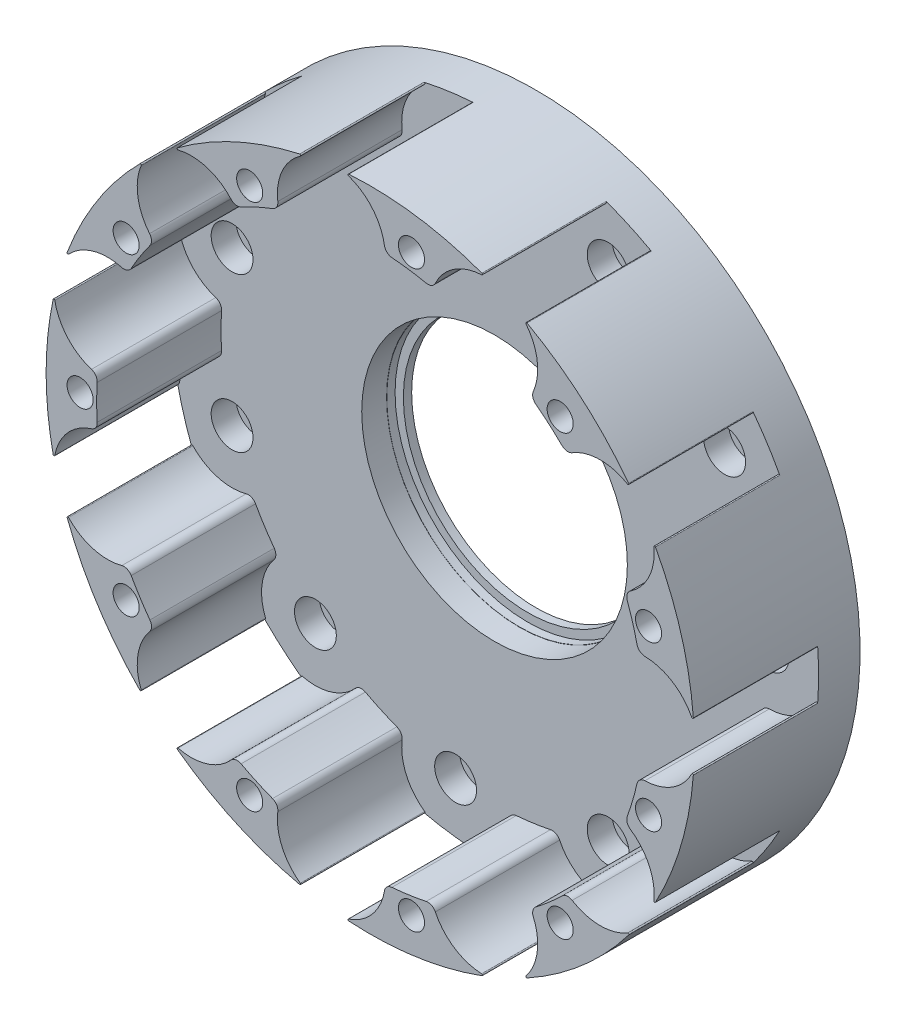
from build123d import *

# Parameters (mm, degrees)
SKETCH1_R           = 39.1
SKETCH1_R_2         = 2.525
SKETCH1_R_3         = 16.025
BOSS_EXTRUDE1_DEPTH = 3
BOSS_EXTRUDE2_START = 2
SKETCH2_R           = 39.1
SKETCH2_R_2         = 16
BOSS_EXTRUDE2_DEPTH = 2
SKETCH4_R           = 16
SKETCH4_R_2         = 15
BOSS_EXTRUDE3_DEPTH = 1
BOSS_EXTRUDE4_DEPTH = 15
FILLET1_R           = 0.1
FILLET2_R           = 1
SKETCH7_R           = 1.575
CUT_EXTRUDE1_DEPTH  = 59.801530759
CUT_EXTRUDE3_DEPTH  = 3


with BuildPart() as part:
    # Sketch1 → Boss-Extrude1 (new body)
    with BuildSketch(Plane.XY):
        Circle(SKETCH1_R)
        with Locations((33, 0)):
            Circle(SKETCH1_R_2, mode=Mode.SUBTRACT)
        with Locations((27.761366583, -17.841146976)):
            Circle(SKETCH1_R_2, mode=Mode.SUBTRACT)
        with Locations((13.708695429, -30.017855847)):
            Circle(SKETCH1_R_2, mode=Mode.SUBTRACT)
        with Locations((-4.696389663, -32.664107582)):
            Circle(SKETCH1_R_2, mode=Mode.SUBTRACT)
        with Locations((-21.61040422, -24.939735954)):
            Circle(SKETCH1_R_2, mode=Mode.SUBTRACT)
        with Locations((-31.663268129, -9.297174376)):
            Circle(SKETCH1_R_2, mode=Mode.SUBTRACT)
        with Locations((-31.663268129, 9.297174376)):
            Circle(SKETCH1_R_2, mode=Mode.SUBTRACT)
        with Locations((-21.61040422, 24.939735954)):
            Circle(SKETCH1_R_2, mode=Mode.SUBTRACT)
        with Locations((-4.696389663, 32.664107582)):
            Circle(SKETCH1_R_2, mode=Mode.SUBTRACT)
        with Locations((13.708695429, 30.017855847)):
            Circle(SKETCH1_R_2, mode=Mode.SUBTRACT)
        with Locations((27.761366583, 17.841146976)):
            Circle(SKETCH1_R_2, mode=Mode.SUBTRACT)
        Circle(SKETCH1_R_3, mode=Mode.SUBTRACT)
    extrude(amount=BOSS_EXTRUDE1_DEPTH)

    # Sketch2 → Boss-Extrude2 (add)
    with BuildSketch(Plane(origin=(0, 0, 0), x_dir=(-1, 0, 0), z_dir=(0, 0, -1)).offset(BOSS_EXTRUDE2_START)):
        Circle(SKETCH2_R)
        Circle(SKETCH2_R_2, mode=Mode.SUBTRACT)
    extrude(amount=-BOSS_EXTRUDE2_DEPTH)

    # Sketch4 → Boss-Extrude3 (add)
    with BuildSketch(Plane(origin=(0, 0, -2), x_dir=(-1, 0, 0), z_dir=(0, 0, -1))):
        Circle(SKETCH4_R)
        Circle(SKETCH4_R_2, mode=Mode.SUBTRACT)
    extrude(amount=-BOSS_EXTRUDE3_DEPTH)

    # Sketch5 → Boss-Extrude4 (add)
    with BuildSketch(Plane.XY.offset(3)):
        with BuildLine():
            ThreePointArc((23.725755484, 22.936619776), (27.58110437, 24.338646921), (31.508256901, 23.152532195))
            ThreePointArc((31.508256901, 23.152532195), (25.605054697, 29.549808357), (18.432780316, 34.482497152))
            ThreePointArc((18.432780316, 34.482497152), (20.165714181, 30.764119096), (19.326631004, 26.748482836))
            ThreePointArc((19.326631004, 26.748482836), (21.61040422, 24.939735954), (23.725755484, 22.936619776))
        make_face()
        with BuildLine():
            ThreePointArc((32.359848485, 6.468400578), (36.361167457, 5.563501894), (39.023636364, 2.442499736))
            ThreePointArc((39.023636364, 2.442499736), (37.516175268, 11.015742973), (34.149287009, 19.043009132))
            ThreePointArc((34.149287009, 19.043009132), (33.596816793, 14.978015675), (30.719918236, 12.0534901))
            ThreePointArc((30.719918236, 12.0534901), (31.663268129, 9.297174376), (32.359848485, 6.468400578))
        make_face()
        with BuildLine():
            ThreePointArc((34.149287009, -19.043009132), (37.516175268, -11.015742973), (39.023636364, -2.442499736))
            ThreePointArc((39.023636364, -2.442499736), (36.361167457, -5.563501894), (32.359848485, -6.468400578))
            ThreePointArc((32.359848485, -6.468400578), (31.663268129, -9.297174376), (30.719918236, -12.0534901))
            ThreePointArc((30.719918236, -12.0534901), (33.596816793, -14.978015675), (34.149287009, -19.043009132))
        make_face()
        with BuildLine():
            ThreePointArc((18.432780316, -34.482497152), (25.605054697, -29.549808357), (31.508256901, -23.152532195))
            ThreePointArc((31.508256901, -23.152532195), (27.58110437, -24.338646921), (23.725755484, -22.936619776))
            ThreePointArc((23.725755484, -22.936619776), (21.61040422, -24.939735954), (19.326631004, -26.748482836))
            ThreePointArc((19.326631004, -26.748482836), (20.165714181, -30.764119096), (18.432780316, -34.482497152))
        make_face()
        with BuildLine():
            ThreePointArc((-3.136003888, -38.974035968), (5.564510176, -38.702018378), (13.989228499, -36.511799271))
            ThreePointArc((13.989228499, -36.511799271), (10.044235523, -35.386443519), (7.558902755, -32.122624257))
            ThreePointArc((7.558902755, -32.122624257), (4.696389663, -32.664107582), (1.797274983, -32.951021268))
            ThreePointArc((1.797274983, -32.951021268), (0.3321398, -36.782832073), (-3.136003888, -38.974035968))
        make_face()
        with BuildLine():
            ThreePointArc((-23.709129015, -31.091593741), (-16.242727008, -35.566611018), (-7.971281108, -38.278828058))
            ThreePointArc((-7.971281108, -38.278828058), (-10.681607133, -35.199294329), (-11.00784819, -31.109922504))
            ThreePointArc((-11.00784819, -31.109922504), (-13.708695429, -30.017855847), (-16.302703146, -28.691843269))
            ThreePointArc((-16.302703146, -28.691843269), (-19.60688662, -31.123255762), (-23.709129015, -31.091593741))
        make_face()
        with BuildLine():
            ThreePointArc((-36.7547732, -13.337790184), (-32.893013134, -21.139055963), (-27.400965286, -27.892599402))
            ThreePointArc((-27.400965286, -27.892599402), (-28.016114996, -23.836617895), (-26.079685113, -20.220040169))
            ThreePointArc((-26.079685113, -20.220040169), (-27.761366583, -17.841146976), (-29.226688215, -15.323207758))
            ThreePointArc((-29.226688215, -15.323207758), (-33.320865074, -15.582265653), (-36.7547732, -13.337790184))
        make_face()
        with BuildLine():
            ThreePointArc((-32.871406282, 2.910437948), (-36.455704301, 4.905983702), (-38.131036591, 8.650667516))
            ThreePointArc((-38.131036591, 8.650667516), (-39.1, 0), (-38.131036591, -8.650667516))
            ThreePointArc((-38.131036591, -8.650667516), (-36.455704301, -4.905983702), (-32.871406282, -2.910437948))
            ThreePointArc((-32.871406282, -2.910437948), (-33, 0), (-32.871406282, 2.910437948))
        make_face()
        with BuildLine():
            ThreePointArc((-26.079685113, 20.220040169), (-28.016114996, 23.836617895), (-27.400965286, 27.892599402))
            ThreePointArc((-27.400965286, 27.892599402), (-32.893013134, 21.139055963), (-36.7547732, 13.337790184))
            ThreePointArc((-36.7547732, 13.337790184), (-33.320865074, 15.582265653), (-29.226688215, 15.323207758))
            ThreePointArc((-29.226688215, 15.323207758), (-27.761366583, 17.841146976), (-26.079685113, 20.220040169))
        make_face()
        with BuildLine():
            ThreePointArc((-11.00784819, 31.109922504), (-10.681607133, 35.199294329), (-7.971281108, 38.278828058))
            ThreePointArc((-7.971281108, 38.278828058), (-16.242727008, 35.566611018), (-23.709129015, 31.091593741))
            ThreePointArc((-23.709129015, 31.091593741), (-19.60688662, 31.123255762), (-16.302703146, 28.691843269))
            ThreePointArc((-16.302703146, 28.691843269), (-13.708695429, 30.017855847), (-11.00784819, 31.109922504))
        make_face()
        with BuildLine():
            ThreePointArc((7.558902755, 32.122624257), (10.044235523, 35.386443519), (13.989228499, 36.511799271))
            ThreePointArc((13.989228499, 36.511799271), (5.564510176, 38.702018378), (-3.136003888, 38.974035968))
            ThreePointArc((-3.136003888, 38.974035968), (0.3321398, 36.782832073), (1.797274983, 32.951021268))
            ThreePointArc((1.797274983, 32.951021268), (4.696389663, 32.664107582), (7.558902755, 32.122624257))
        make_face()
    extrude(amount=BOSS_EXTRUDE4_DEPTH)

    # Fillet1
    # the kernel refuses this fillet: 0.1 mm, written as the material it takes off along each edge
    with BuildSketch(Plane(origin=(39.023636364, 2.442499736, 3), x_dir=(-0.06952902748482663, 0.9975799287961913, 0), z_dir=(0, 0, 1)), Plane(origin=(34.149287009, -19.043009132, 3), x_dir=(0.4808408881756103, 0.8768078696376362, 0), z_dir=(0, 0, 1)), Plane(origin=(18.432780316, -34.482497152, 3), x_dir=(0.8785472193000238, 0.47765550709710847, 0), z_dir=(0, 0, 1)), Plane(origin=(-3.136003888, -38.974035968, 3), x_dir=(0.9973210158143226, -0.07314910399374341, 0), z_dir=(0, 0, 1)), Plane(origin=(-23.709129015, -31.091593741, 3), x_dir=(0.7994524365413372, -0.6007293914135708, 0), z_dir=(0, 0, 1)), Plane(origin=(-36.7547732, -13.337790184, 3), x_dir=(0.3477633573267558, -0.9375823416110306, 0), z_dir=(0, 0, 1)), Plane(origin=(-38.131036591, 8.650667516, 3), x_dir=(-0.21433813065990198, -0.9767595229867067, 0), z_dir=(0, 0, 1)), Plane(origin=(-27.400965286, 27.892599402, 3), x_dir=(-0.7083887766027376, -0.7058224572676027, 0), z_dir=(0, 0, 1)), Plane(origin=(-7.971281108, 38.278828058, 3), x_dir=(-0.9775309912106832, -0.21079174846909762, 0), z_dir=(0, 0, 1)), Plane(origin=(13.989228499, 36.511799271, 3), x_dir=(-0.9363140230130107, 0.3511638510854889, 0), z_dir=(0, 0, 1)), Plane(origin=(31.508256901, 23.152532195, 3), x_dir=(-0.5978239681872833, 0.8016274091252182, 0), z_dir=(0, 0, 1))) as fillet1_piece_1:
        with BuildLine():
            CenterArc((0.552665907, 0.099997496), FILLET1_R, 112.920913013, 157.484537541)
            ThreePointArc((0.513719891, 0.192101828), (0.258887015, 0.090630113), (0, 0))
            ThreePointArc((0, 0), (0.276686773, -0.000978984), (0.553373546, 0))
        make_face()
    extrude(amount=16.383433865, mode=Mode.SUBTRACT)
    with BuildSketch(Plane(origin=(34.149287009, 19.043009132, 3), x_dir=(0.4808408881756062, -0.8768078696376386, 0), z_dir=(0, 0, 1)), Plane(origin=(39.023636364, -2.442499736, 3), x_dir=(-0.06952902748482015, -0.9975799287961918, 0), z_dir=(0, 0, 1)), Plane(origin=(31.508256901, -23.152532195, 3), x_dir=(-0.597823968187293, -0.801627409125211, 0), z_dir=(0, 0, 1)), Plane(origin=(13.989228499, -36.511799271, 3), x_dir=(-0.9363140230130192, -0.351163851085466, 0), z_dir=(0, 0, 1)), Plane(origin=(-7.971281108, -38.278828058, 3), x_dir=(-0.9775309912106843, 0.21079174846909224, 0), z_dir=(0, 0, 1)), Plane(origin=(-27.400965286, -27.892599402, 3), x_dir=(-0.7083887766027217, 0.7058224572676186, 0), z_dir=(0, 0, 1)), Plane(origin=(-38.131036591, -8.650667516, 3), x_dir=(-0.21433813065991056, 0.9767595229867048, 0), z_dir=(0, 0, 1)), Plane(origin=(-36.7547732, 13.337790184, 3), x_dir=(0.3477633573267474, 0.9375823416110337, 0), z_dir=(0, 0, 1)), Plane(origin=(-23.709129015, 31.091593741, 3), x_dir=(0.7994524365413179, 0.6007293914135966, 0), z_dir=(0, 0, 1)), Plane(origin=(-3.136003888, 38.974035968, 3), x_dir=(0.9973210158143253, 0.07314910399370772, 0), z_dir=(0, 0, 1)), Plane(origin=(18.432780316, 34.482497152, 3), x_dir=(0.8785472193000408, -0.4776555070970774, 0), z_dir=(0, 0, 1))) as fillet1_piece_2:
        with BuildLine():
            CenterArc((0.552665907, -0.099997496), FILLET1_R, 89.594549446, 157.484537541)
            ThreePointArc((0.513719891, -0.192101828), (0.258887015, -0.090630113), (0, 0))
            ThreePointArc((0, 0), (0.276686773, 0.000978984), (0.553373546, 0))
        make_face()
    extrude(amount=16.383433865, mode=Mode.SUBTRACT)

    # Fillet2
    fillet2_edges = [part.edges().sort_by_distance(p)[0] for p in [
        (30.719918236, 12.0534901, 10.5),
        (32.359848485, 6.468400578, 10.5),
        (32.359848485, -6.468400578, 10.5),
        (30.719918236, -12.0534901, 10.5),
        (23.725755484, -22.936619776, 10.5),
        (19.326631004, -26.748482836, 10.5),
        (7.558902755, -32.122624257, 10.5),
        (1.797274983, -32.951021268, 10.5),
        (-11.00784819, -31.109922504, 10.5),
        (-16.302703146, -28.691843269, 10.5),
        (-26.079685113, -20.220040169, 10.5),
        (-29.226688215, -15.323207758, 10.5),
        (-32.871406282, -2.910437948, 10.5),
        (-32.871406282, 2.910437948, 10.5),
        (-29.226688215, 15.323207758, 10.5),
        (-26.079685113, 20.220040169, 10.5),
        (-16.302703146, 28.691843269, 10.5),
        (-11.00784819, 31.109922504, 10.5),
        (1.797274983, 32.951021268, 10.5),
        (7.558902755, 32.122624257, 10.5),
        (19.326631004, 26.748482836, 10.5),
        (23.725755484, 22.936619776, 10.5),
    ]]
    fillet(fillet2_edges, radius=FILLET2_R)

    # Sketch7 → Cut-Extrude1 (cut, through all)
    with BuildSketch(Plane(origin=(0, 0, -2), x_dir=(-1, 0, 0), z_dir=(0, 0, -1))):
        with Locations((35, 0)):
            Circle(SKETCH7_R)
        with Locations((29.443873649, -18.922428611)):
            Circle(SKETCH7_R)
        with Locations((14.539525455, -31.837119837)):
            Circle(SKETCH7_R)
        with Locations((-4.98101934, -34.643750466)):
            Circle(SKETCH7_R)
        with Locations((-22.920125688, -26.451235102)):
            Circle(SKETCH7_R)
        with Locations((-33.582254077, -9.860639489)):
            Circle(SKETCH7_R)
        with Locations((-33.582254077, 9.860639489)):
            Circle(SKETCH7_R)
        with Locations((-22.920125688, 26.451235102)):
            Circle(SKETCH7_R)
        with Locations((-4.98101934, 34.643750466)):
            Circle(SKETCH7_R)
        with Locations((14.539525455, 31.837119837)):
            Circle(SKETCH7_R)
        with Locations((29.443873649, 18.922428611)):
            Circle(SKETCH7_R)
    extrude(amount=-CUT_EXTRUDE1_DEPTH, mode=Mode.SUBTRACT)

    # Sketch8 → Cut-Extrude3 (cut)
    with BuildSketch(Plane(origin=(0, 0, -2), x_dir=(-1, 0, 0), z_dir=(0, 0, -1))):
        Polygon((32.212351985, -20.701621603), (32.368939147, -17.414452539), (29.600460811, -15.635259546), (26.675395313, -17.143235618), (26.518808151, -20.430404683), (29.287286487, -22.209597676), align=None)
        Polygon((38.290896534, 0), (36.645448267, 2.85), (33.354551733, 2.85), (31.709103466, 0), (33.354551733, -2.85), (36.645448267, -2.85), align=None)
        Polygon((15.906613282, -34.830624618), (17.815520555, -32.149939441), (16.448432729, -29.15643466), (13.172437628, -28.843615056), (11.263530355, -31.524300234), (12.630618182, -34.517805015), align=None)
        Polygon((-5.449362748, -37.901150419), (-2.394199934, -36.678047731), (-1.925856526, -33.420647779), (-4.512675932, -31.386350513), (-7.567838745, -32.6094532), (-8.036182153, -35.866853153), align=None)
        Polygon((-25.075204608, -28.938328758), (-21.843778861, -29.561135022), (-19.688699941, -27.074041367), (-20.765046768, -23.964141447), (-23.996472515, -23.341335183), (-26.151551435, -25.828428838), align=None)
        Polygon((-36.739846178, -10.787792184), (-34.35811234, -13.058770812), (-31.200520239, -12.131618117), (-30.424661975, -8.933486795), (-32.806395813, -6.662508167), (-35.963987914, -7.589660862), align=None)
        Polygon((-36.739846178, 10.787792184), (-35.963987914, 7.589660862), (-32.806395813, 6.662508167), (-30.424661975, 8.933486795), (-31.200520239, 12.131618117), (-34.35811234, 13.058770812), align=None)
        Polygon((-25.075204608, 28.938328758), (-26.151551435, 25.828428838), (-23.996472515, 23.341335183), (-20.765046768, 23.964141447), (-19.688699941, 27.074041367), (-21.843778861, 29.561135022), align=None)
        Polygon((-5.449362748, 37.901150419), (-8.036182153, 35.866853153), (-7.567838745, 32.6094532), (-4.512675932, 31.386350513), (-1.925856526, 33.420647779), (-2.394199934, 36.678047731), align=None)
        Polygon((15.906613282, 34.830624618), (12.630618182, 34.517805015), (11.263530355, 31.524300234), (13.172437628, 28.843615056), (16.448432729, 29.15643466), (17.815520555, 32.149939441), align=None)
        Polygon((32.212351985, 20.701621603), (29.287286487, 22.209597676), (26.518808151, 20.430404683), (26.675395313, 17.143235618), (29.600460811, 15.635259546), (32.368939147, 17.414452539), align=None)
    extrude(amount=-CUT_EXTRUDE3_DEPTH, mode=Mode.SUBTRACT)


solid = part.part
